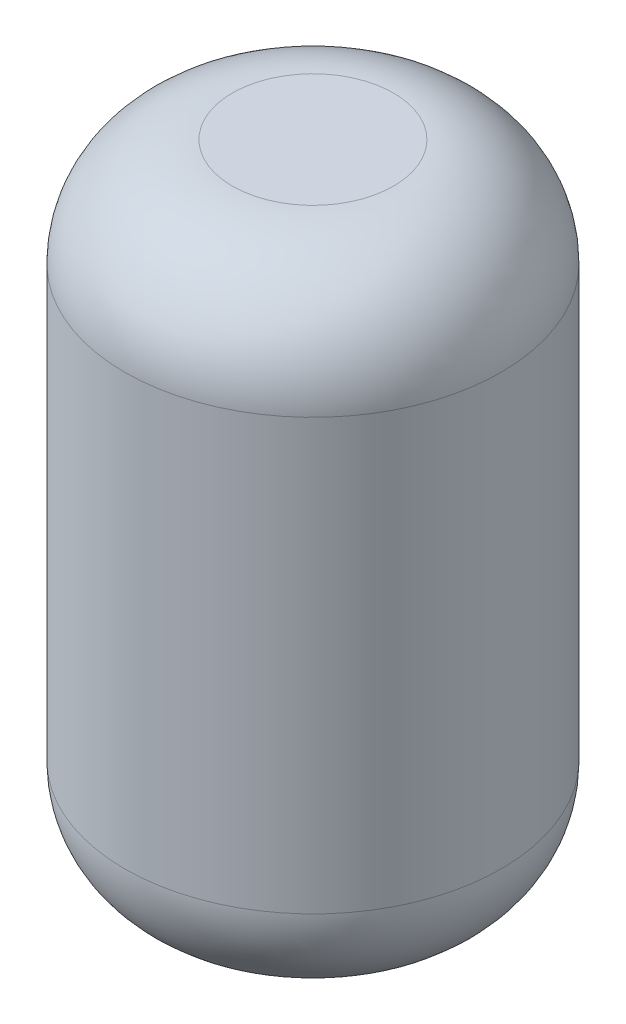
from build123d import *

# Parameters (mm, degrees)
SKETCH1_R           = 2.1
BOSS_EXTRUDE1_DEPTH = 7.2
FILLET1_R           = 1.2


with BuildPart() as part:
    # Sketch1 → Boss-Extrude1 (new body)
    with BuildSketch(Plane(origin=(0, 0, 0), x_dir=(1, 0, 0), z_dir=(0, 1, 0))):
        Circle(SKETCH1_R)
    extrude(amount=BOSS_EXTRUDE1_DEPTH)

    # Fillet1
    fillet1_edges = [part.edges().sort_by_distance(p)[0] for p in [
        (-2.1, 0, 0),
        (-2.1, 7.2, 0),
    ]]
    fillet(fillet1_edges, radius=FILLET1_R)


solid = part.part
